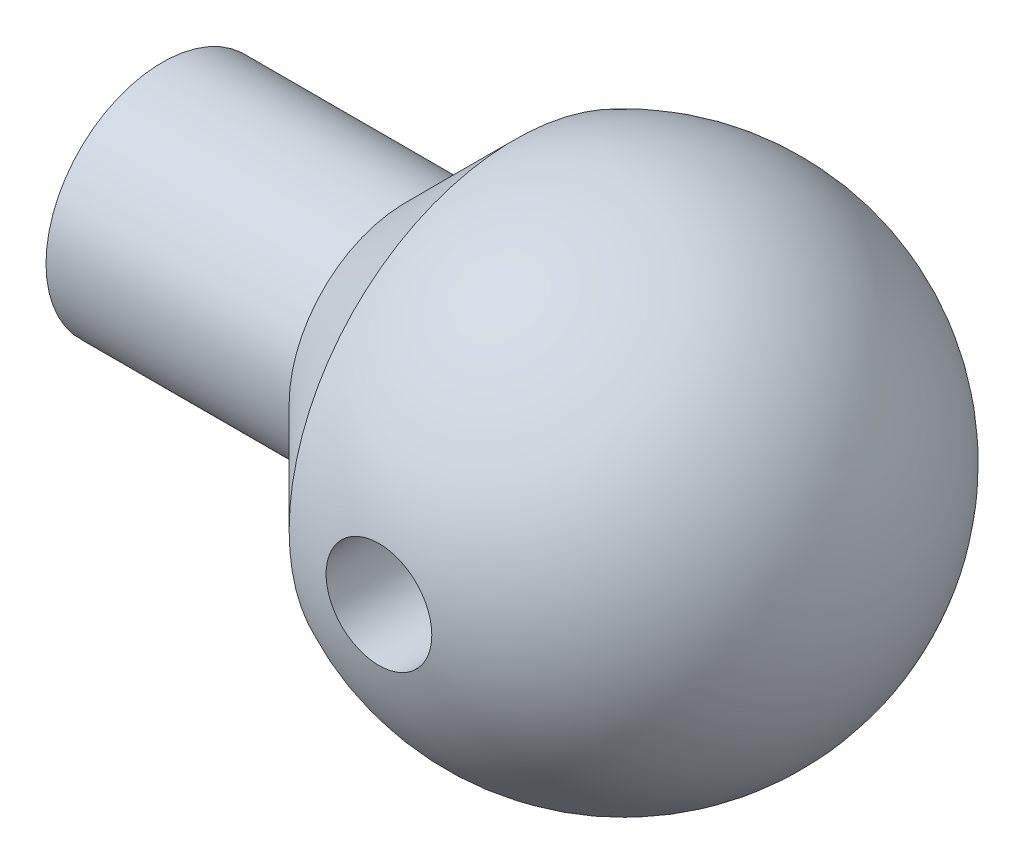
from build123d import *

# Parameters (mm, degrees)
CUT_EXTRUDE_1_DEPTH      = 25.366329598
CUT_EXTRUDE_1_DEPTH_BACK = 25.366329598
SKETCH_8_R               = 1.5


with BuildPart() as part:
    # 草图1 → 旋转1 (revolve)
    with BuildSketch(Plane.XY):
        with BuildLine():
            Line((0, 0), (1.982840043, -3.3))
            Line((1.982840043, -3.3), (8.882840043, -3.3))
            Line((8.882840043, -3.3), (11.982840043, -6.4))
            ThreePointArc((11.982840043, -6.4), (18.859419057, -6.025566442), (22.194098722, 0))
            Line((22.194098722, 0), (0, 0))
        make_face()
    revolve(axis=Axis((0, 0, 0), (1, 0, 0)))

    # 草图8 → 切除-拉伸1 (cut, two sides: drawn at the far end of the back side and taken through both)
    with BuildSketch(Plane.XY.offset(-CUT_EXTRUDE_1_DEPTH_BACK)):
        with Locations((15.082840043, 0)):
            Circle(SKETCH_8_R)
    extrude(amount=CUT_EXTRUDE_1_DEPTH + CUT_EXTRUDE_1_DEPTH_BACK, mode=Mode.SUBTRACT)


solid = part.part
